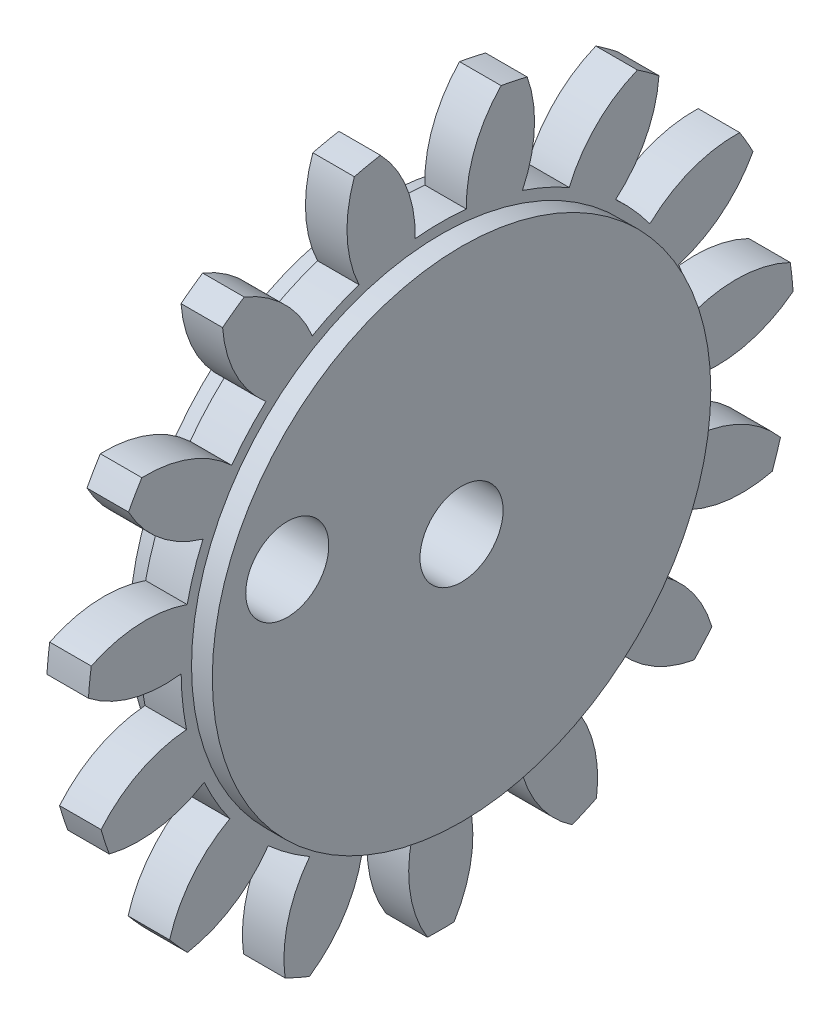
from build123d import *

# Parameters (mm, degrees)
BASPROSKE_W        = 6.35
BASPROSKE_H        = 53.975
TOOTHCUT_DEPTH     = 77.59584682
TEETHCUTS_COUNT    = 15
TEETHCUTS_ANGLE    = 336
HUBNEABOTSKE_R     = 38.1
HUBNEARBOTH_DEPTH  = 3.1750254
HUBFAR_START       = 3.1750254
HUBFARSKE_R        = 38.1
HUBFAR_DEPTH       = 3.1750254
BORSKE_R           = 6.35
BORE_DEPTH         = 12.7000508
SKETCH1_R          = 6.35
CUT_EXTRUDE1_DEPTH = 78.297193623


with BuildPart() as part:
    # BasProSke → Base-Revolve (revolve)
    with BuildSketch(Plane(origin=(0, 0, 0), x_dir=(1, 0, 0), z_dir=(0, 1, 0))):
        with Locations((3.175, 26.9875)):
            Rectangle(BASPROSKE_W, BASPROSKE_H)
    revolve(axis=Axis((-10, 0, 0), (1, 0, 0)))

    # TooCutSke → ToothCut (cut, through all)
    with BuildSketch(Plane(origin=(0, 0, 0), x_dir=(0, 0, -1), z_dir=(1, 0, 0))):
        with BuildLine():
            ThreePointArc((3.91547882, 39.492605349), (0, 39.68623), (-3.91547882, 39.492605349))
            ThreePointArc((-3.91547882, 39.492605349), (-5.201686692, 46.882953453), (-9.241355572, 53.20376441))
            ThreePointArc((-9.241355572, 53.20376441), (0, 54.0004), (9.241355572, 53.20376441))
            ThreePointArc((9.241355572, 53.20376441), (5.201686692, 46.882953453), (3.91547882, 39.492605349))
        make_face()
    toothcut = extrude(amount=TOOTHCUT_DEPTH, mode=Mode.SUBTRACT)

    # TeethCuts: ToothCut ×15 about axis
    teethcuts_axis = Axis((-10, 0, 0), (1, 0, 0))
    for i in range(1, TEETHCUTS_COUNT):
        add(toothcut.rotate(teethcuts_axis, i * TEETHCUTS_ANGLE / (TEETHCUTS_COUNT - 1)), mode=Mode.SUBTRACT)

    # HubNeaBotSke → HubNearBoth (add)
    with BuildSketch(Plane.ZY):
        Circle(HUBNEABOTSKE_R)
    extrude(amount=HUBNEARBOTH_DEPTH)

    # HubFarSke → HubFar (add)
    with BuildSketch(Plane(origin=(6.35, 0, 0), x_dir=(0, 0, -1), z_dir=(1, 0, 0)).offset(HUBFAR_START)):
        Circle(HUBFARSKE_R)
    extrude(amount=-HUBFAR_DEPTH)

    # BorSke → Bore (cut, symmetric)
    with BuildSketch(Plane(origin=(0, 0, 0), x_dir=(0, 0, -1), z_dir=(1, 0, 0))):
        Circle(BORSKE_R)
    extrude(amount=BORE_DEPTH, both=True, mode=Mode.SUBTRACT)

    # Sketch1 → Cut-Extrude1 (cut, through all)
    with BuildSketch(Plane.ZY.offset(3.1750254)):
        with Locations((26.638896337, 8.655502106)):
            Circle(SKETCH1_R)
    extrude(amount=-CUT_EXTRUDE1_DEPTH, mode=Mode.SUBTRACT)


solid = part.part
